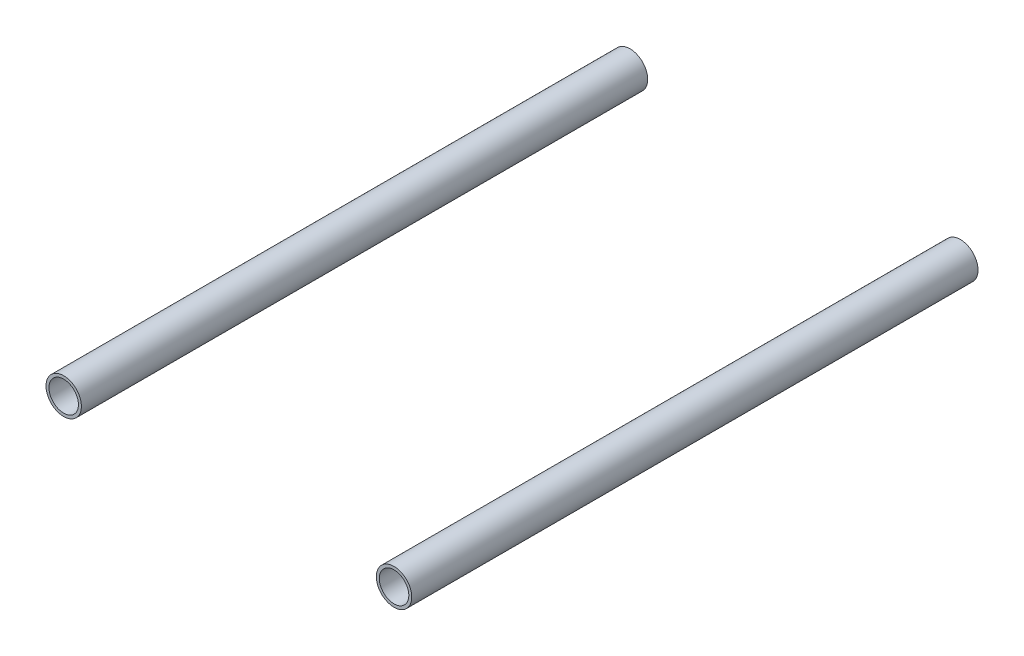
from build123d import *

# Parameters (mm, degrees)
SKETCH1_R             = 9.525
SKETCH1_R_2           = 7.9375
BOSS_EXTRUDE1_DEPTH   = 152.4
BOSS_EXTRUDE1_2_DEPTH = 152.4


with BuildPart() as part:
    # Sketch1 → Boss-Extrude1 (new, symmetric)
    with BuildSketch(Plane.XY):
        Circle(SKETCH1_R)
        Circle(SKETCH1_R_2, mode=Mode.SUBTRACT)
    extrude(amount=BOSS_EXTRUDE1_DEPTH, both=True)


with BuildPart() as body_2:
    # Sketch1 → Boss-Extrude1 2 (new, symmetric)
    with BuildSketch(Plane.XY):
        with Locations((177.8, 0)):
            Circle(SKETCH1_R)
        with Locations((177.8, 0)):
            Circle(SKETCH1_R_2, mode=Mode.SUBTRACT)
    extrude(amount=BOSS_EXTRUDE1_2_DEPTH, both=True)


solid = Compound([part.part, body_2.part])
